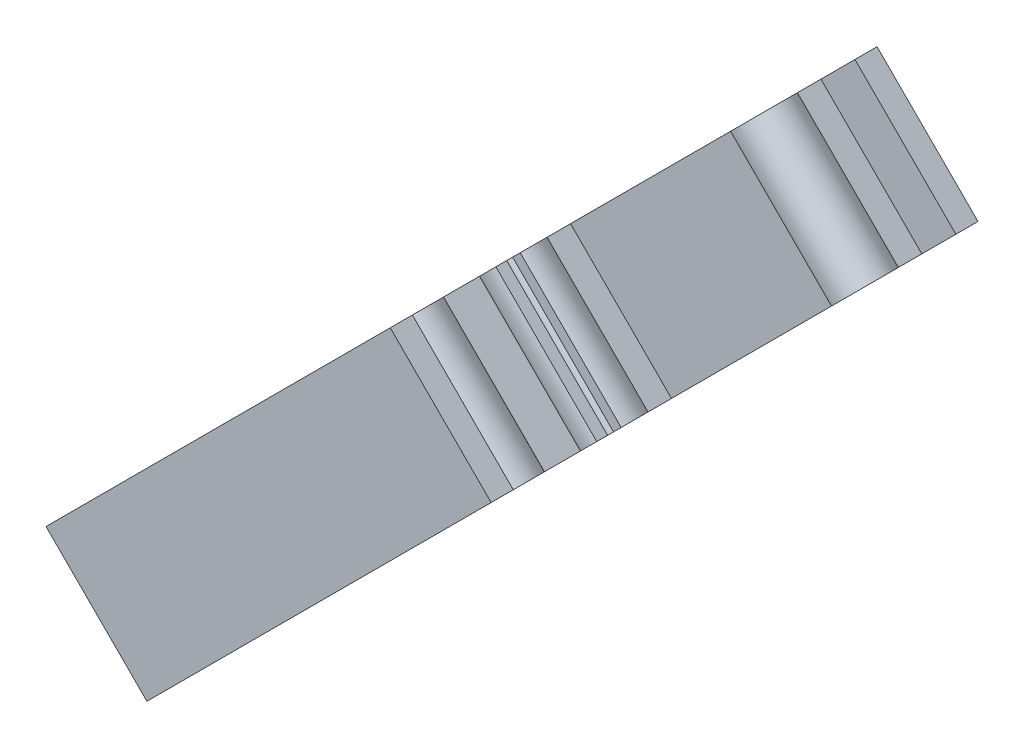
from build123d import *

# Parameters (mm, degrees)
BOSS_EXTRUDE1_DEPTH = 12.9
FILLET1_R           = 5
FILLET2_R           = 1
FILLET3_R           = 0.5


with BuildPart() as part:
    # Sketch2 → Boss-Extrude1 (new body)
    with BuildSketch(Plane(origin=(-7.378322523, 7.378322523, 0), x_dir=(0, 0, 1), z_dir=(-0.7071067811865452, 0.7071067811865498, 0))):
        with BuildLine():
            Line((56.29999994, -16.741883092), (56.29999994, -19.091883092))
            Line((56.29999994, -19.091883092), (16.29999994, -19.091883092))
            Line((16.29999994, -19.091883092), (16.29999994, -16.741883092))
            Line((16.29999994, -16.741883092), (18.421835943, -16.741883092))
            ThreePointArc((18.421835943, -16.741883092), (21.641004351, -17.201790003), (22.591287788, -14.091883092))
            Line((22.591287788, -14.091883092), (22.29999994, -14.091883092))
            Line((22.29999994, -14.091883092), (21.612440415, -14.091883092))
            ThreePointArc((21.612440415, -14.091883092), (21.863334003, -14.564164788), (21.94999994, -15.091883092))
            ThreePointArc((21.94999994, -15.091883092), (18.821402632, -15.824174018), (21.29999994, -13.779442617))
            Line((21.29999994, -13.779442617), (21.29999994, -13.091883092))
            Line((21.29999994, -13.091883092), (21.29999994, -12.800595245))
            ThreePointArc((21.29999994, -12.800595245), (19.756303769, -12.651720296), (18.421835943, -13.441883092))
            Line((18.421835943, -13.441883092), (16.29999994, -13.441883092))
            Line((16.29999994, -13.441883092), (16.29999994, 15.258116908))
            Line((16.29999994, 15.258116908), (18.421835943, 15.258116908))
            ThreePointArc((18.421835943, 15.258116908), (19.756303769, 14.467954112), (21.29999994, 14.61682906))
            Line((21.29999994, 14.61682906), (21.29999994, 14.908116908))
            Line((21.29999994, 14.908116908), (21.29999994, 15.595676433))
            ThreePointArc((21.29999994, 15.595676433), (18.821402632, 17.640407834), (21.94999994, 16.908116908))
            ThreePointArc((21.94999994, 16.908116908), (21.863334003, 16.380398604), (21.612440415, 15.908116908))
            Line((21.612440415, 15.908116908), (22.29999994, 15.908116908))
            Line((22.29999994, 15.908116908), (22.591287788, 15.908116908))
            ThreePointArc((22.591287788, 15.908116908), (21.641004351, 19.018023818), (18.421835943, 18.558116908))
            Line((18.421835943, 18.558116908), (16.29999994, 18.558116908))
            Line((16.29999994, 18.558116908), (16.29999994, 22.908116908))
            Line((16.29999994, 22.908116908), (14.29999994, 22.908116908))
            Line((14.29999994, 22.908116908), (14.29999994, -21.091883092))
            Line((14.29999994, -21.091883092), (58.29999994, -21.091883092))
            Line((58.29999994, -21.091883092), (58.29999994, 22.908116908))
            Line((58.29999994, 22.908116908), (56.29999994, 22.908116908))
            Line((56.29999994, 22.908116908), (56.29999994, 18.558116541))
            Line((56.29999994, 18.558116541), (54.178163937, 18.558116908))
            ThreePointArc((54.178163937, 18.558116908), (50.95899553, 19.018023818), (50.008712093, 15.908116908))
            Line((50.008712093, 15.908116908), (50.29999994, 15.908116908))
            Line((50.29999994, 15.908116908), (50.987559466, 15.908116908))
            ThreePointArc((50.987559466, 15.908116908), (51.772281637, 18.471450971), (53.94999994, 16.908116908))
            ThreePointArc((53.94999994, 16.908116908), (53.032290866, 15.4295196), (51.29999994, 15.595676433))
            Line((51.29999994, 15.595676433), (51.29999994, 14.908116908))
            Line((51.29999994, 14.908116908), (51.29999994, 14.61682906))
            ThreePointArc((51.29999994, 14.61682906), (52.843696112, 14.467954112), (54.178163937, 15.258116908))
            Line((54.178163937, 15.258116908), (56.29999994, 15.258116908))
            Line((56.29999994, 15.258116908), (56.29999994, -13.441883092))
            Line((56.29999994, -13.441883092), (54.178163937, -13.441883092))
            ThreePointArc((54.178163937, -13.441883092), (52.843696112, -12.651720296), (51.29999994, -12.800595245))
            Line((51.29999994, -12.800595245), (51.29999994, -13.091883092))
            Line((51.29999994, -13.091883092), (51.29999994, -13.779442617))
            ThreePointArc((51.29999994, -13.779442617), (53.032290866, -13.613285784), (53.94999994, -15.091883092))
            ThreePointArc((53.94999994, -15.091883092), (51.772281637, -16.655217155), (50.987559466, -14.091883092))
            Line((50.987559466, -14.091883092), (50.29999994, -14.091883092))
            Line((50.29999994, -14.091883092), (50.008712093, -14.091883092))
            ThreePointArc((50.008712093, -14.091883092), (50.95899553, -17.201790003), (54.178163937, -16.741883092))
            Line((54.178163937, -16.741883092), (56.29999994, -16.741883092))
        make_face()
    extrude(amount=BOSS_EXTRUDE1_DEPTH)

    # Fillet1
    # the kernel refuses this fillet: 5 mm, written as the material it adds along each edge
    with BuildSketch(Plane(origin=(-20.878322523, -6.121677477, 56.29999994), x_dir=(0, 0, -1), z_dir=(-0.7071067811865452, 0.7071067811865498, 0))) as fillet1_piece_1:
        with BuildLine():
            CenterArc((4.239988208, -5), FILLET1_R, 90, 57.994545172)
            Line((0, -2.35), (-0.084799764, -2.297))
            ThreePointArc((-0.084799764, -2.297), (-0.1, -1.175), (-0.1, 0))
            Line((-0.1, 0), (0, 0.1))
            Line((0, 0.1), (4.239988208, 0.1))
            Line((4.239988208, 0.1), (4.239988208, 0))
        make_face()
    extrude(amount=12.9)
    with BuildSketch(Plane(origin=(-20.878322523, -6.121677477, 16.29999994), x_dir=(0.7071067811865498, 0.7071067811865452, 4.67144053935759e-13), z_dir=(-0.7071067811865452, 0.7071067811865498, 0))) as fillet1_piece_2:
        with BuildLine():
            CenterArc((5, -4.239988208), FILLET1_R, 122.005454828, 57.994545172)
            Line((0, -4.239988208), (-0.1, -4.239988208))
            Line((-0.1, -4.239988208), (-0.1, 0))
            Line((-0.1, 0), (0, 0.1))
            ThreePointArc((0, 0.1), (1.175, 0.1), (2.297, 0.084799764))
            Line((2.297, 0.084799764), (2.35, 0))
        make_face()
    extrude(amount=12.9)

    # Fillet2
    # the kernel refuses this fillet: 1 mm, written as the material it adds along each edge
    with BuildSketch(Plane(origin=(-19.216621587, -4.459976542, 16.29999994), x_dir=(-0.4742981469837023, -0.4742981469836992, 0.7416754920689071), z_dir=(-0.7071067811865452, 0.7071067811865498, 0))) as fillet2_piece_1:
        with BuildLine():
            CenterArc((2.460931793, 0.961889952), FILLET2_R, 152.5257211, 133.343162112)
            Line((1.573713762, 1.423240324), (1.555969401, 1.432467331))
            ThreePointArc((1.555969401, 1.432467331), (0.773441703, 0.726453672), (-0.013415177, 0.01483351))
            Line((-0.013415177, 0.01483351), (-0.005468737, -0.019237799))
            ThreePointArc((-0.005468737, -0.019237799), (1.367184329, -0.210550238), (2.739837396, -0.019237799))
            Line((2.739837396, -0.019237799), (2.734368658, 0))
        make_face()
    extrude(amount=12.9)
    with BuildSketch(Plane(origin=(-19.216621587, -4.459976542, 56.29999994), x_dir=(-0.47429814698388373, -0.4742981469838806, -0.7416754920686752), z_dir=(-0.7071067811865452, 0.7071067811865498, 0))) as fillet2_piece_2:
        with BuildLine():
            CenterArc((2.460931793, -0.961889952), FILLET2_R, 74.131116788, 133.343162112)
            Line((1.573713762, -1.423240324), (1.555969401, -1.432467331))
            ThreePointArc((1.555969401, -1.432467331), (0.773441703, -0.726453672), (-0.013415177, -0.01483351))
            Line((-0.013415177, -0.01483351), (-0.005468737, 0.019237799))
            ThreePointArc((-0.005468737, 0.019237799), (1.367184329, 0.210550238), (2.739837396, 0.019237799))
            Line((2.739837396, 0.019237799), (2.734368658, 0))
        make_face()
    extrude(amount=12.9)

    # Fillet3
    fillet3_edges = [part.edges().sort_by_distance(p)[0] for p in [
        (-23.777460326, 0.100862197, 18.421835943),
        (-23.777460326, 0.100862197, 54.178163937),
    ]]
    fillet(fillet3_edges, radius=FILLET3_R)


solid = part.part
